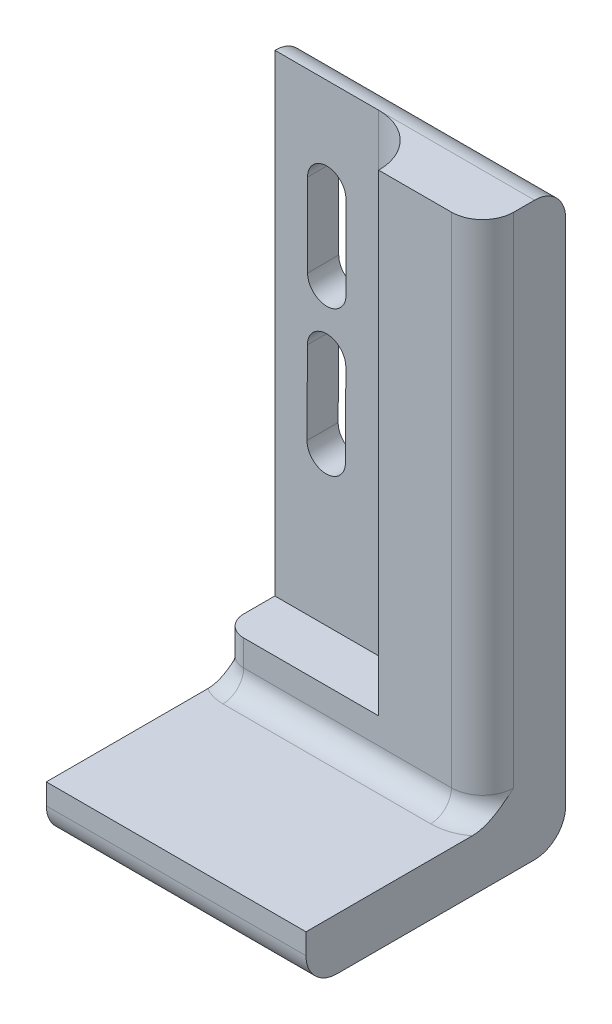
from build123d import *
from OCP.BRepFilletAPI import BRepFilletAPI_MakeFillet

# Parameters (mm, degrees)
SKETCH1_W           = 30
SKETCH1_H           = 50
BOSS_EXTRUDE1_DEPTH = 3
SKETCH2_W           = 30
SKETCH2_H           = 5
BOSS_EXTRUDE2_DEPTH = 25
BOSS_EXTRUDE4_START = 3
BOSS_EXTRUDE4_DEPTH = 5
SKETCH6_W           = 5
SKETCH6_H           = 55
CUT_EXTRUDE1_DEPTH  = 35
FILLET3_R           = 5
FILLET5_R           = 3
FILLET5_R_2         = 2
FILLET6_R           = 2


with BuildPart() as part:
    # Sketch1 → Boss-Extrude1 (new body)
    with BuildSketch(Plane.XY):
        Rectangle(SKETCH1_W, SKETCH1_H)
        with BuildLine():
            Line((-11.85, 8), (-11.85, 16))
            ThreePointArc((-11.85, 16), (-10, 17.85), (-8.15, 16))
            Line((-8.15, 16), (-8.15, 8))
            ThreePointArc((-8.15, 8), (-10, 6.15), (-11.85, 8))
        make_face(mode=Mode.SUBTRACT)
        with BuildLine():
            Line((-11.864504809, 2.008993176), (-11.903242133, -5.990913037))
            ThreePointArc((-11.903242133, -5.990913037), (-10.062221828, -7.849849355), (-8.203285509, -6.008829049))
            Line((-8.203285509, -6.008829049), (-8.164548185, 1.991077164))
            ThreePointArc((-8.164548185, 1.991077164), (-10.00556849, 3.850013482), (-11.864504809, 2.008993176))
        make_face(mode=Mode.SUBTRACT)
    extrude(amount=BOSS_EXTRUDE1_DEPTH)

    # Sketch2 → Boss-Extrude2 (add)
    with BuildSketch(Plane.XY):
        with Locations((0, -27.5)):
            Rectangle(SKETCH2_W, SKETCH2_H)
    extrude(amount=BOSS_EXTRUDE2_DEPTH)

    # Sketch4 → Boss-Extrude4 (add)
    with BuildSketch(Plane.XY.offset(BOSS_EXTRUDE4_START)):
        Polygon((15, -25), (0, -25), (-15, -25), (-15, -20.5), (0, -20.5), (0, 25), (15, 25), align=None)
    extrude(amount=BOSS_EXTRUDE4_DEPTH)

    # Sketch6 → Cut-Extrude1 (cut)
    with BuildSketch(Plane.XY):
        with Locations((12.5, -2.5)):
            Rectangle(SKETCH6_W, SKETCH6_H)
    extrude(amount=CUT_EXTRUDE1_DEPTH, mode=Mode.SUBTRACT)

    # Fillet3
    fillet3_edges = [part.edges().sort_by_distance(p)[0] for p in [
        (0, 2.25, 3),
    ]]
    fillet(fillet3_edges, radius=FILLET3_R - 0.0001)  # a hair under: the kernel refuses the full size

    # Fillet5
    fillet5_edges_1 = [part.edges().sort_by_distance(p)[0] for p in [
        (-2.5, -30, 0),
        (-2.5, -30, 25),
        (10, 0, 8),
        (-2.5, 25, 0),
    ]]
    fillet5_edges_2 = [part.edges().sort_by_distance(p)[0] for p in [
        (-15, -22.75, 8),
    ]]
    fillet5 = BRepFilletAPI_MakeFillet(part.part.solid().wrapped)
    for e in fillet5_edges_1:
        fillet5.Add(FILLET5_R - 0.0001, e.wrapped)
    for e in fillet5_edges_2:
        fillet5.Add(FILLET5_R_2 - 0.0001, e.wrapped)
    add(Compound.cast(fillet5.Shape()), mode=Mode.REPLACE)  # a hair under: the kernel refuses the full size

    # Fillet6
    fillet6_edges = [part.edges().sort_by_distance(p)[0] for p in [
        (-3, -25, 8),
        (-14.414242852, -25, 7.414242852),
        (9.121349633, -25, 7.121349633),
    ]]
    fillet(fillet6_edges, radius=FILLET6_R)


solid = part.part
